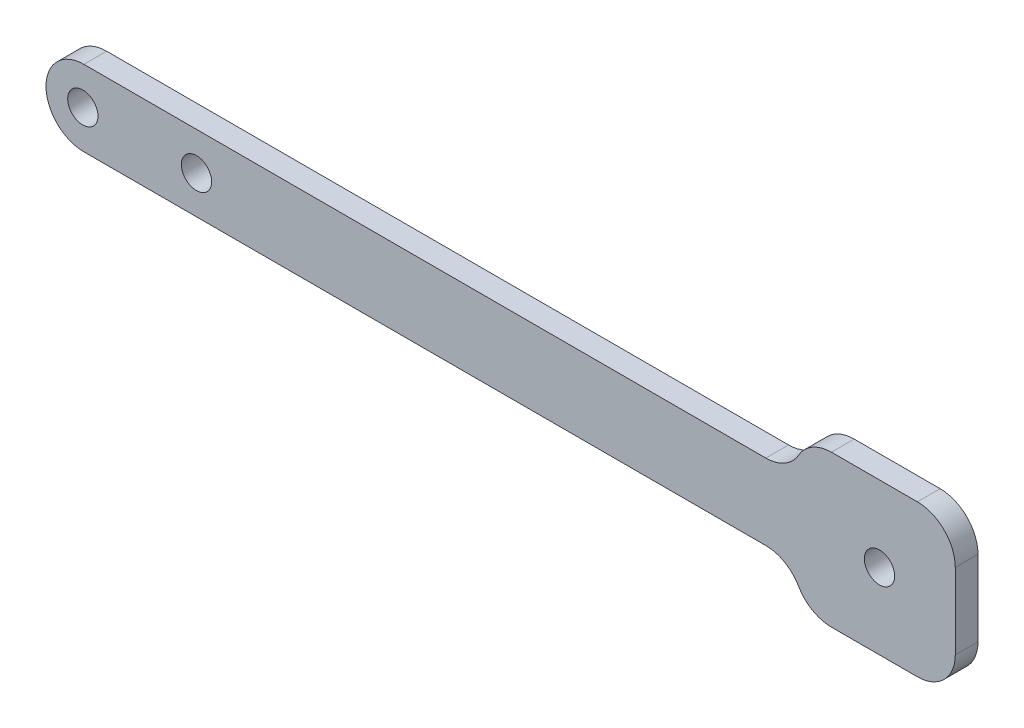
from build123d import *

# Parameters (mm, degrees)
SKETCH_1_R      = 2
EXTRUDE_1_DEPTH = 3
FILLET_2_R      = 5
FILLET_3_R      = 5
FILLET_4_R      = 5


with BuildPart() as part:
    # 草图1 → 凸台-拉伸1 (new body)
    with BuildSketch(Plane.XY):
        Polygon((-60, 5), (40, 5), (40, 10), (60, 10), (60, -10), (40, -10), (40, -5), (-60, -5), align=None)
        with Locations((-55.138487595, 0)):
            Circle(SKETCH_1_R, mode=Mode.SUBTRACT)
        with Locations((-40.138487595, 0)):
            Circle(SKETCH_1_R, mode=Mode.SUBTRACT)
        with Locations((50, 0)):
            Circle(SKETCH_1_R, mode=Mode.SUBTRACT)
    extrude(amount=EXTRUDE_1_DEPTH)

    # 圆角2
    fillet_2_edges = [part.edges().sort_by_distance(p)[0] for p in [
        (-60, -5, 1.5),
        (-60, 5, 1.5),
        (60, -10, 1.5),
        (60, 10, 1.5),
    ]]
    fillet(fillet_2_edges, radius=FILLET_2_R - 0.0001)  # a hair under: the kernel refuses the full size

    # 圆角3
    fillet_3_edges = [part.edges().sort_by_distance(p)[0] for p in [
        (40, -5, 1.5),
        (40, 5, 1.5),
    ]]
    fillet(fillet_3_edges, radius=FILLET_3_R - 0.0001)  # a hair under: the kernel refuses the full size

    # 圆角4
    fillet_4_edges = [part.edges().sort_by_distance(p)[0] for p in [
        (40, -10, 1.5),
        (40, 10, 1.5),
    ]]
    fillet(fillet_4_edges, radius=FILLET_4_R)


solid = part.part
